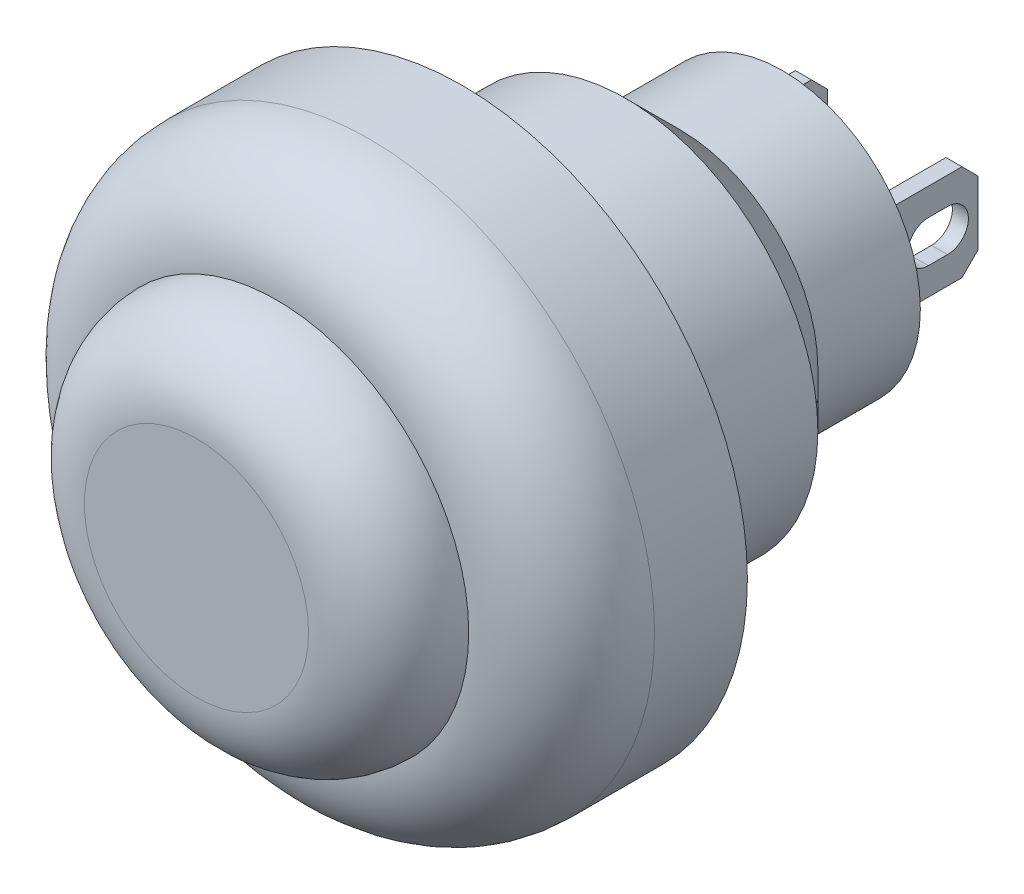
from build123d import *

# Parameters (mm, degrees)
SKETCH_1_R          = 8.9
EXTRUDE_1_DEPTH     = 5.8
FILLET_2_R          = 2.9
SKETCH_2_R          = 6.75
EXTRUDE_2_DEPTH     = 1
SKETCH_3_R          = 6
EXTRUDE_3_DEPTH     = 7.5
SKETCH_4_R          = 4.3
EXTRUDE_4_DEPTH     = 1.5
CHAMFER_1_SIZE      = 3.4
EXTRUDE_5_DEPTH     = 3.5
CUT_EXTRUDE_1_DEPTH = 6.5
CHAMFER_2_SIZE      = 0.5
EXTRUDE_START       = 2.5
SKETCH_7_R          = 6
EXTRUDE_6_DEPTH     = 2.5
FILLET_3_R          = 2.5


# Some blends are built 0.0001 mm under size
with BuildPart() as part:
    # 草图1 → 凸台-拉伸1 (new body)
    with BuildSketch(Plane.XY):
        Circle(SKETCH_1_R)
    extrude(amount=EXTRUDE_1_DEPTH)

    # 圆角2
    fillet_2_edges = [part.edges().sort_by_distance(p)[0] for p in [
        (-8.9, 0, 5.8),
    ]]
    fillet(fillet_2_edges, radius=FILLET_2_R)

    # 草图2 → 凸台-拉伸2 (add)
    with BuildSketch(Plane(origin=(0, 0, 0), x_dir=(-1, 0, 0), z_dir=(0, 0, -1))):
        with Locations(Location((0, 0, 0), (0, 0, 180))):
            Circle(SKETCH_2_R)
    extrude(amount=EXTRUDE_2_DEPTH)

    # 草图3 → 凸台-拉伸3 (add)
    with BuildSketch(Plane(origin=(0, 0, -1), x_dir=(-1, 0, 0), z_dir=(0, 0, -1))):
        Circle(SKETCH_3_R)
    extrude(amount=EXTRUDE_3_DEPTH)

    # 草图4 → 凸台-拉伸4 (add)
    with BuildSketch(Plane(origin=(0, 0, -8.5), x_dir=(-1, 0, 0), z_dir=(0, 0, -1))):
        Circle(SKETCH_4_R)
    extrude(amount=EXTRUDE_4_DEPTH)

    # 倒角1
    # the kernel refuses this chamfer: 3.4 mm, written as the material it takes off along each edge
    with BuildSketch(Plane(origin=(0, 0, -8.5), x_dir=(-1, 0, 0), z_dir=(0, -1, 0))) as chamfer_1_piece_1_section:
        Polygon((6, -CHAMFER_1_SIZE), (6 - CHAMFER_1_SIZE, 0), (6, 0), align=None)
    chamfer_1_piece_1 = revolve(axis=Axis((0, 0, -8.5), (0, 0, -1)), mode=Mode.PRIVATE)
    chamfer_1_piece_1 = chamfer_1_piece_1 - Plane(origin=(0, 0, -5.94008013), x_dir=(-1, 0, 0), z_dir=(0, 0, 1)) * Cylinder(4.3, 24, mode=Mode.PRIVATE)
    add(chamfer_1_piece_1, mode=Mode.SUBTRACT)

    # 草图5 → 凸台-拉伸5 (add)
    with BuildSketch(Plane(origin=(0, 0, -10), x_dir=(-1, 0, 0), z_dir=(0, 0, -1))):
        Polygon((-2.6, 1.5), (-2.1, 1.5), (-2.1, 0), (-2.1, -1.5), (-2.6, -1.5), align=None)
        Polygon((2.1, 0), (2.1, 1.5), (2.6, 1.5), (2.6, -1.5), (2.1, -1.5), align=None)
    extrude(amount=EXTRUDE_5_DEPTH)

    # 草图6 → 切除-拉伸1 (cut)
    with BuildSketch(Plane.ZY.offset(2.6)):
        with BuildLine():
            Line((-12.55, 0.65), (-11.95, 0.65))
            ThreePointArc((-11.95, 0.65), (-11.3, 0), (-11.95, -0.65))
            Line((-11.95, -0.65), (-12.55, -0.65))
            ThreePointArc((-12.55, -0.65), (-13.2, 0), (-12.55, 0.65))
        make_face()
    extrude(amount=-CUT_EXTRUDE_1_DEPTH, mode=Mode.SUBTRACT)

    # 倒角2
    chamfer_2_edges = [part.edges().sort_by_distance(p)[0] for p in [
        (-2.35, -1.5, -13.5),
        (-2.35, 1.5, -13.5),
        (2.35, -1.5, -13.5),
        (2.35, 1.5, -13.5),
    ]]
    chamfer(chamfer_2_edges, length=CHAMFER_2_SIZE)

    # 草图7 → 凸台-拉伸6 (add)
    with BuildSketch(Plane.XY.offset(5.8).offset(EXTRUDE_START)):
        with Locations(Location((0, 0, 0), (0, 0, 180))):
            Circle(SKETCH_7_R)
    extrude(amount=-EXTRUDE_6_DEPTH)

    # 圆角3
    fillet_3_edges = [part.edges().sort_by_distance(p)[0] for p in [
        (6, 0, 8.3),
    ]]
    fillet(fillet_3_edges, radius=FILLET_3_R - 0.0001)  # a hair under: the kernel refuses the full size


solid = part.part
